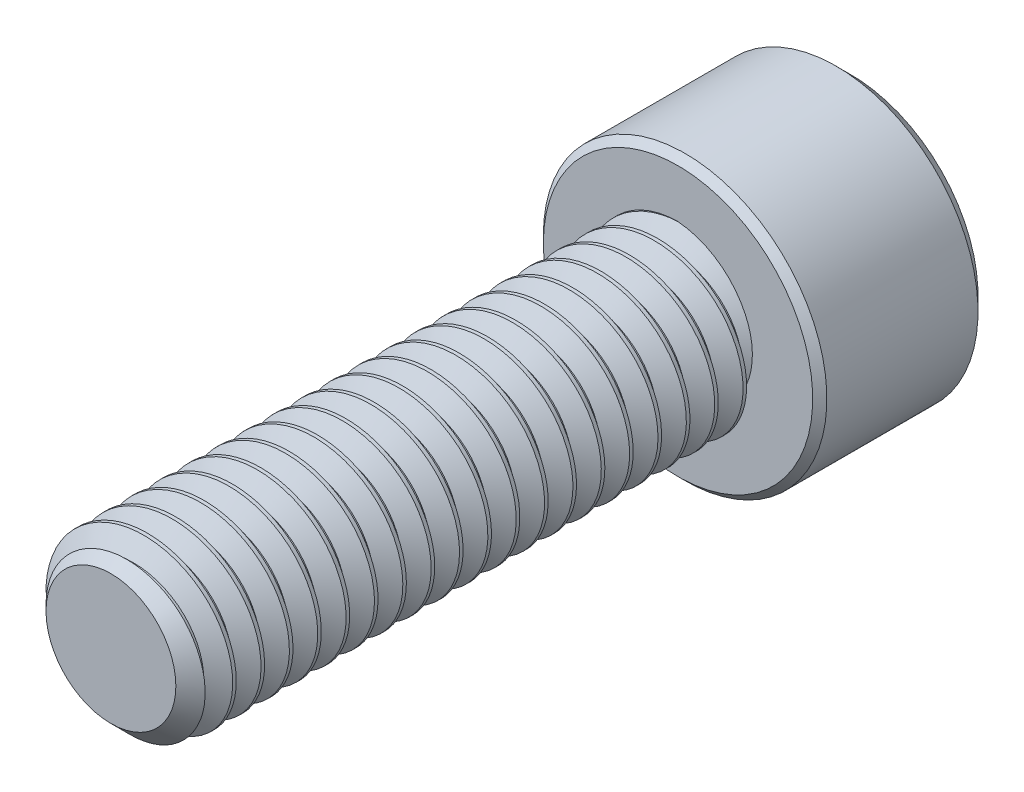
from build123d import *

# Parameters (mm, degrees)
SKETCH1_R          = 2.413
EXTRUDE1_DEPTH     = 15.875
CHAMFER3_SIZE      = 0.5953125
CUT_SWEEP1_PITCH   = 0.79375
SKETCH6_R          = 3.96875
EXTRUDE2_DEPTH     = 4.826
CUT_EXTRUDE1_DEPTH = 2.9765625
CHAMFER1_SIZE      = 0.396875
CHAMFER2_SIZE      = 0.1984375


with BuildPart() as part:
    # Sketch1 → Extrude1 (new body)
    with BuildSketch(Plane.XY):
        Circle(SKETCH1_R)
    extrude(amount=-EXTRUDE1_DEPTH)

    # Chamfer3
    chamfer3_edges = [part.edges().sort_by_distance(p)[0] for p in [
        (-2.413, 0, 0),
    ]]
    chamfer(chamfer3_edges, length=CHAMFER3_SIZE)

    # Cut-Sweep1: the profile of Sketch3 profile screwed along a right-hand helix of 21 turns, 6 arcs to a turn; built about Z, then put on its axis
    cut_sweep1_z = Axis((0, 0, 0), (0, 0, 1))
    cut_sweep1_corners = [(2.4133, 0, -0.694704455), (1.897444252, 0, -0.396875), (1.897444252, 0, -0.29765625), (2.4133, 0, 0.000173205)]
    with BuildLine(mode=Mode.PRIVATE) as cut_sweep1_profile:
        Line(cut_sweep1_corners[0], cut_sweep1_corners[1])
        Line(cut_sweep1_corners[1], cut_sweep1_corners[2])
        Line(cut_sweep1_corners[2], cut_sweep1_corners[3])
        Line(cut_sweep1_corners[3], cut_sweep1_corners[0])
    cut_sweep1_cap = Face(cut_sweep1_profile.wire())
    cut_sweep1_turn_angles = [0, 30, 60, 90, 120, 150, 180, 210, 240, 270, 300, 330, 360]
    cut_sweep1_turn_weights = [1, 0.8660254037844387, 1, 0.8660254037844387, 1, 0.8660254037844387, 1, 0.8660254037844387, 1, 0.8660254037844387, 1, 0.8660254037844387, 1]
    cut_sweep1_turn_rails = [Edge.make_bspline([Vector(p[0], p[1], 0).rotate(cut_sweep1_z, cut_sweep1_turn_angles[k]) / cut_sweep1_turn_weights[k] + Vector(0, 0, p[2] + CUT_SWEEP1_PITCH * cut_sweep1_turn_angles[k] / 360) for k in range(13)], [0, 0, 0, 1, 1, 2, 2, 3, 3, 4, 4, 5, 5, 6, 6, 6], 2, cut_sweep1_turn_weights) for p in cut_sweep1_corners]
    cut_sweep1_turn_sides = [Face.make_surface_from_curves(cut_sweep1_turn_rails[p[0]], cut_sweep1_turn_rails[p[1]]) for p in [(0, 1), (1, 2), (2, 3), (3, 0)]]
    cut_sweep1 = Plane(origin=(0, 0, 0), x_dir=(0, 1, 0), z_dir=(0, 0, -1)) * Solid(Shell([*[p.moved(Location((0, 0, CUT_SWEEP1_PITCH * i))) for i in range(21) for p in cut_sweep1_turn_sides], cut_sweep1_cap, cut_sweep1_cap.rotate(cut_sweep1_z, 7560).moved(Location((0, 0, CUT_SWEEP1_PITCH * 7560 / 360)))]))
    add(cut_sweep1, mode=Mode.SUBTRACT)

    # Sketch6 → Extrude2 (add)
    with BuildSketch(Plane(origin=(0, 0, -15.875), x_dir=(-1, 0, 0), z_dir=(0, 0, -1))):
        Circle(SKETCH6_R)
    extrude(amount=EXTRUDE2_DEPTH)

    # Sketch7 → Cut-Extrude1 (cut)
    with BuildSketch(Plane(origin=(0, 0, -20.701), x_dir=(-1, 0, 0), z_dir=(0, 0, -1))):
        Polygon((0, 2.291358881), (-1.984375, 1.14567944), (-1.984375, -1.14567944), (0, -2.291358881), (1.984375, -1.14567944), (1.984375, 1.14567944), align=None)
    extrude(amount=-CUT_EXTRUDE1_DEPTH, mode=Mode.SUBTRACT)

    # Cut-Extrude2 cone 1 section (through the dimple's axis) → Cut-Extrude2 (revolve, cut)
    with BuildSketch(Plane(origin=(0, 0, -20.701), x_dir=(0, 1, 0), z_dir=(1, 0, 0))):
        Polygon((0, 0), (2.291358881, 0), (0, 2.291358881), align=None)
    revolve(axis=Axis((0, 0, -20.701), (0, 0, 1)), mode=Mode.SUBTRACT)

    # Chamfer1
    chamfer1_edges = [part.edges().sort_by_distance(p)[0] for p in [
        (3.96875, 0, -20.701),
    ]]
    chamfer(chamfer1_edges, length=CHAMFER1_SIZE)

    # Chamfer2
    chamfer2_edges = [part.edges().sort_by_distance(p)[0] for p in [
        (3.96875, 0, -15.875),
    ]]
    chamfer(chamfer2_edges, length=CHAMFER2_SIZE)


solid = part.part
